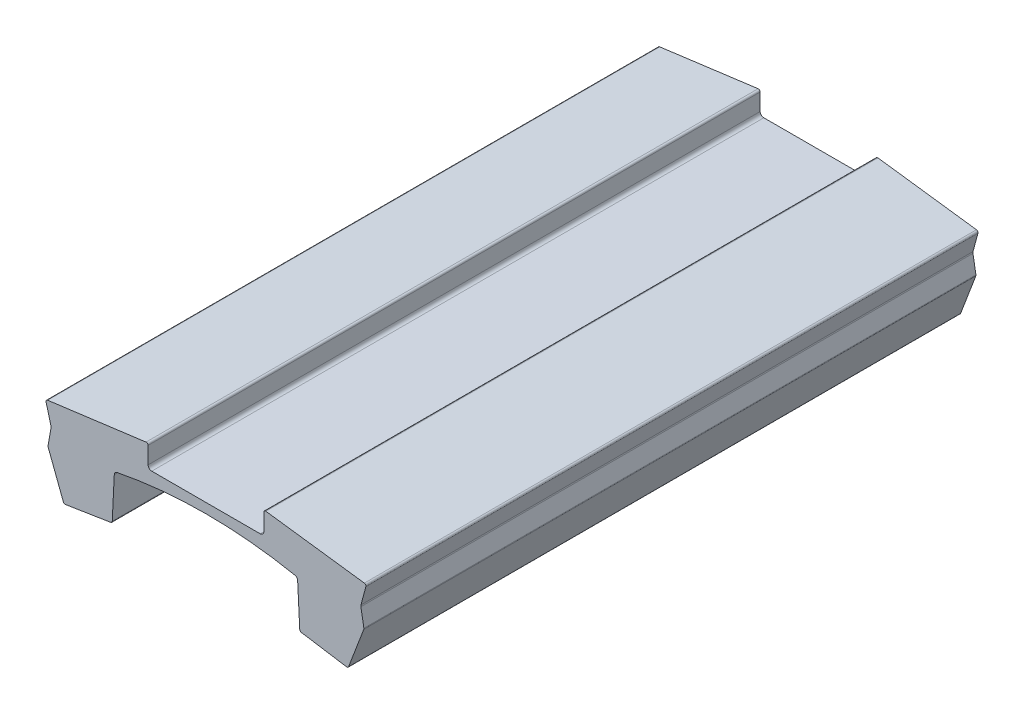
from build123d import *

# Parameters (mm, degrees)
BOSS_EXTRUDE2_DEPTH = 67.5


with BuildPart() as part:
    # Sketch1 → Boss-Extrude2 (new body)
    with BuildSketch(Plane.XY):
        with BuildLine():
            Line((-17.624839098, 90.556097537), (-17.081964944, 88.53006361))
            ThreePointArc((-17.081964944, 88.53006361), (-17.06872461, 88.444180172), (-17.07434408, 88.357464009))
            Line((-17.07434408, 88.357464009), (-17.406101009, 86.465100374))
            ThreePointArc((-17.406101009, 86.465100374), (-17.408194108, 86.4114937), (-17.395962494, 86.359259189))
            Line((-17.395962494, 86.359259189), (-15.714560006, 81.953100992))
            ThreePointArc((-15.714560006, 81.953100992), (-15.62787368, 81.851299803), (-15.496416031, 81.826868517))
            Line((-15.496416031, 81.826868517), (-10.495838808, 82.618882142))
            ThreePointArc((-10.495838808, 82.618882142), (-10.378300643, 82.682811793), (-10.327369953, 82.806538448))
            Line((-10.327369953, 82.806538448), (-10.101894168, 87.364622968))
            ThreePointArc((-10.101894168, 87.364622968), (-10.0050052, 87.606431661), (-9.779768503, 87.737303149))
            ThreePointArc((-9.779768503, 87.737303149), (0.009655574, 88.693275712), (9.799075243, 87.737258013))
            ThreePointArc((9.799075243, 87.737258013), (10.024185058, 87.606531513), (10.121179929, 87.364961975))
            Line((10.121179929, 87.364961975), (10.351109341, 82.805609758))
            ThreePointArc((10.351109341, 82.805609758), (10.40209464, 82.682003526), (10.519568611, 82.618145345))
            Line((10.519568611, 82.618145345), (15.520145834, 81.82613172))
            ThreePointArc((15.520145834, 81.82613172), (15.65168662, 81.850611141), (15.738358224, 81.952543733))
            Line((15.738358224, 81.952543733), (17.415135527, 86.359286022))
            ThreePointArc((17.415135527, 86.359286022), (17.427307864, 86.411436625), (17.425205627, 86.464947668))
            Line((17.425205627, 86.464947668), (17.093421927, 88.357464009))
            ThreePointArc((17.093421927, 88.357464009), (17.087802457, 88.444180172), (17.101042791, 88.53006361))
            Line((17.101042791, 88.53006361), (17.643916946, 90.556097537))
            ThreePointArc((17.643916946, 90.556097537), (17.617025703, 90.718975393), (17.476837019, 90.806150319))
            Line((17.476837019, 90.806150319), (6.615644162, 92.236053485))
            ThreePointArc((6.615644162, 92.236053485), (6.457669761, 92.188132474), (6.389538924, 92.037764513))
            Line((6.389538924, 92.037764513), (6.389538924, 90.17390614))
            ThreePointArc((6.389538924, 90.17390614), (6.272381636, 89.891063428), (5.989538924, 89.77390614))
            Line((5.989538924, 89.77390614), (-5.970461076, 89.77390614))
            ThreePointArc((-5.970461076, 89.77390614), (-6.253303789, 89.891063428), (-6.370461076, 90.17390614))
            Line((-6.370461076, 90.17390614), (-6.370461076, 92.037764513))
            ThreePointArc((-6.370461076, 92.037764513), (-6.438591913, 92.188132474), (-6.596566315, 92.236053485))
            Line((-6.596566315, 92.236053485), (-17.457759172, 90.806150319))
            ThreePointArc((-17.457759172, 90.806150319), (-17.597947856, 90.718975393), (-17.624839098, 90.556097537))
        make_face()
    extrude(amount=BOSS_EXTRUDE2_DEPTH)


solid = part.part
